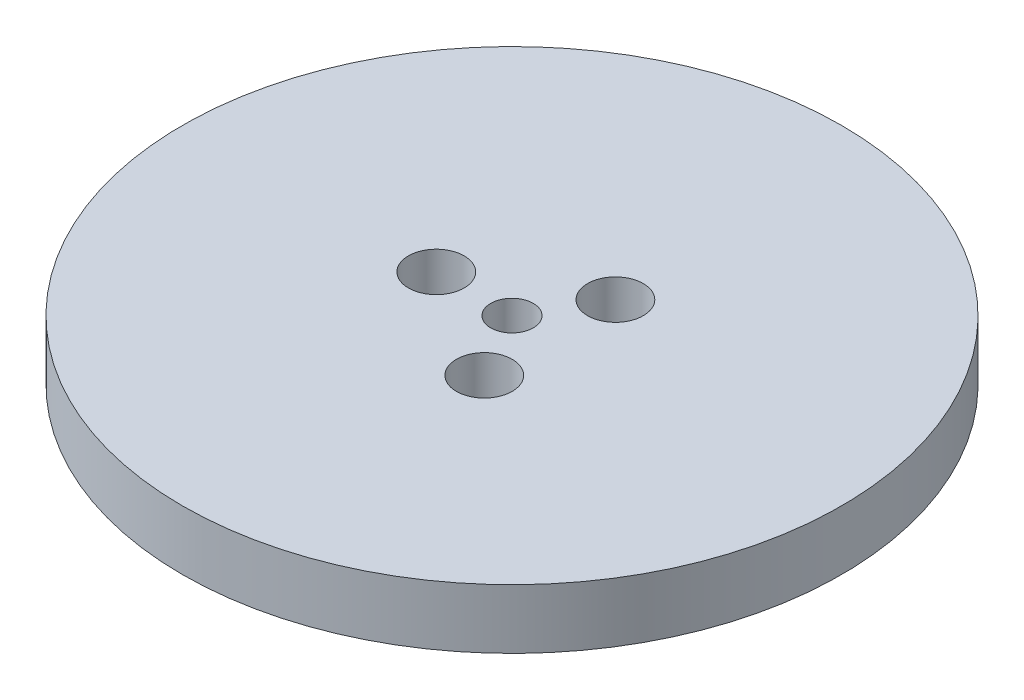
from build123d import *

# Parameters (mm, degrees)
SKETCH1_R           = 77.5
BOSS_EXTRUDE1_DEPTH = 14
SKETCH2_R           = 5
CUT_EXTRUDE1_DEPTH  = 111.492081164
SKETCH3_R           = 6.554273801
CUT_EXTRUDE2_DEPTH  = 13.474309695
CIRPATTERN1_COUNT   = 3


with BuildPart() as part:
    # Sketch1 → Boss-Extrude1 (new body)
    with BuildSketch(Plane(origin=(0, 0, 0), x_dir=(1, 0, 0), z_dir=(0, 1, 0))):
        Circle(SKETCH1_R)
    extrude(amount=BOSS_EXTRUDE1_DEPTH)

    # Sketch2 → Cut-Extrude1 (cut, through all)
    with BuildSketch(Plane(origin=(0, 0, 0), x_dir=(1, 0, 0), z_dir=(0, 1, 0))):
        Circle(SKETCH2_R)
    extrude(amount=CUT_EXTRUDE1_DEPTH, mode=Mode.SUBTRACT)

    # Sketch3 → Cut-Extrude2 (cut)
    with BuildSketch(Plane(origin=(0, 14, 0), x_dir=(1, 0, 0), z_dir=(0, 1, 0))):
        with Locations((-17.803946786, 0)):
            Circle(SKETCH3_R)
    cut_extrude2 = extrude(amount=-CUT_EXTRUDE2_DEPTH, mode=Mode.SUBTRACT)

    # CirPattern1: Cut-Extrude2 ×3 about axis
    cirpattern1_axis = Axis((0, 0, 0), (0, 1, 0))
    for i in range(1, CIRPATTERN1_COUNT):
        add(cut_extrude2.rotate(cirpattern1_axis, i * 360 / CIRPATTERN1_COUNT), mode=Mode.SUBTRACT)


solid = part.part
